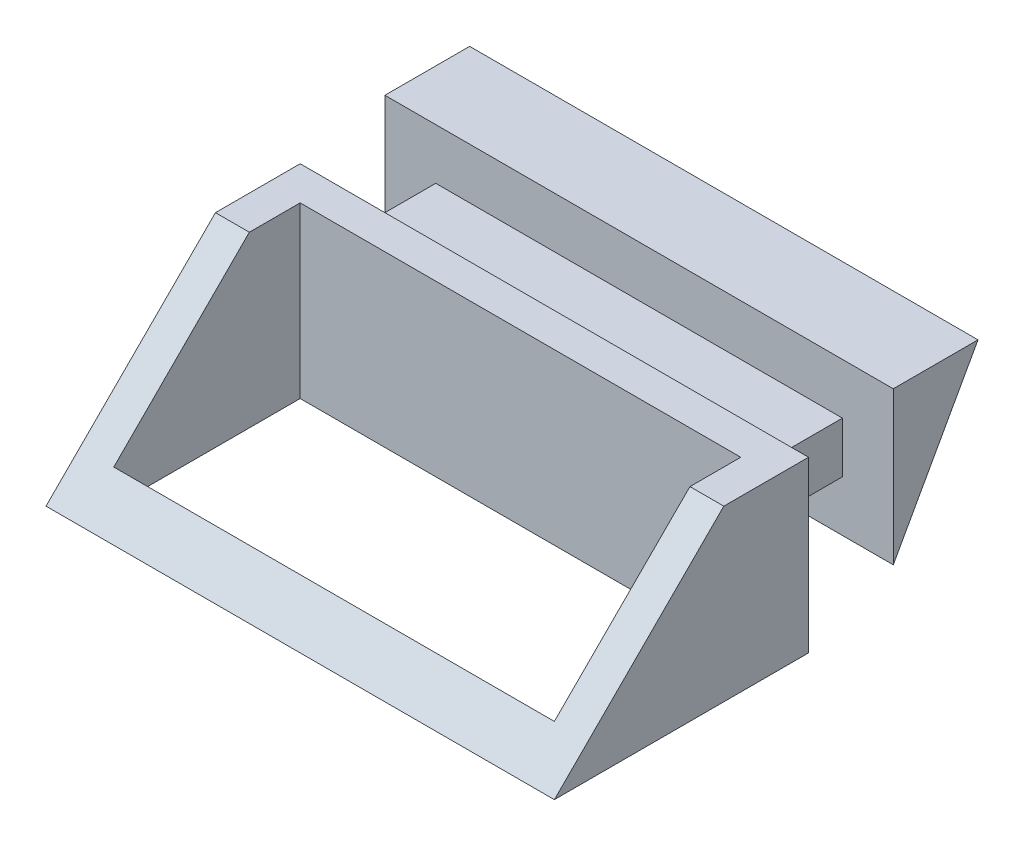
from build123d import *

# Parameters (mm, degrees)
SKETCH12_W               = 30
SKETCH12_H               = 15
BOSS_EXTRUDE4_DEPTH      = 10
CHAMFER1_SIZE            = 10
SKETCH14_W               = 24
SKETCH14_H               = 3
BOSS_EXTRUDE5_DEPTH      = 5
SKETCH15_W               = 30
SKETCH15_H               = 9
BOSS_EXTRUDE6_DEPTH      = 5
CUT_EXTRUDE10_DEPTH      = 37.431442464
CUT_EXTRUDE10_DEPTH_BACK = 37.431442464
CUT_EXTRUDE11_DEPTH      = 26.539185578
CUT_EXTRUDE11_DEPTH_BACK = 26.539185578
SKETCH18_W               = 26
SKETCH18_H               = 11


with BuildPart() as part:
    # Sketch12 → Boss-Extrude4 (new body)
    with BuildSketch(Plane(origin=(0, 0, 0), x_dir=(1, 0, 0), z_dir=(0, 1, 0))):
        Rectangle(SKETCH12_W, SKETCH12_H)
    extrude(amount=BOSS_EXTRUDE4_DEPTH)

    # Chamfer1
    chamfer1_edges = [part.edges().sort_by_distance(p)[0] for p in [
        (0, 10, 7.5),
    ]]
    chamfer(chamfer1_edges, length=CHAMFER1_SIZE - 0.0001)  # a hair under: the kernel refuses the full size

    # Sketch14 → Boss-Extrude5 (add)
    with BuildSketch(Plane(origin=(0, 0, -7.5), x_dir=(-1, 0, 0), z_dir=(0, 0, -1))):
        with Locations((0, 6.5)):
            Rectangle(SKETCH14_W, SKETCH14_H)
    extrude(amount=BOSS_EXTRUDE5_DEPTH)

    # Sketch15 → Boss-Extrude6 (add)
    with BuildSketch(Plane(origin=(0, 0, -12.5), x_dir=(-1, 0, 0), z_dir=(0, 0, -1))):
        with Locations((0, 6.5)):
            Rectangle(SKETCH15_W, SKETCH15_H)
    extrude(amount=BOSS_EXTRUDE6_DEPTH)

    # Sketch17 → Cut-Extrude10 (cut, two sides: drawn at the far end of the back side and taken through both)
    with BuildSketch(Plane.ZY.offset(15).offset(-CUT_EXTRUDE10_DEPTH_BACK)):
        Polygon((-12.5, 2), (-17.5, 11), (-17.5, 2), align=None)
    extrude(amount=CUT_EXTRUDE10_DEPTH + CUT_EXTRUDE10_DEPTH_BACK, mode=Mode.SUBTRACT)

    # Sketch18 → Cut-Extrude11 (cut, two sides: drawn at the far end of the back side and taken through both)
    with BuildSketch(Plane.XZ.offset(-CUT_EXTRUDE11_DEPTH_BACK)):
        Rectangle(SKETCH18_W, SKETCH18_H)
    extrude(amount=CUT_EXTRUDE11_DEPTH + CUT_EXTRUDE11_DEPTH_BACK, mode=Mode.SUBTRACT)


solid = part.part
